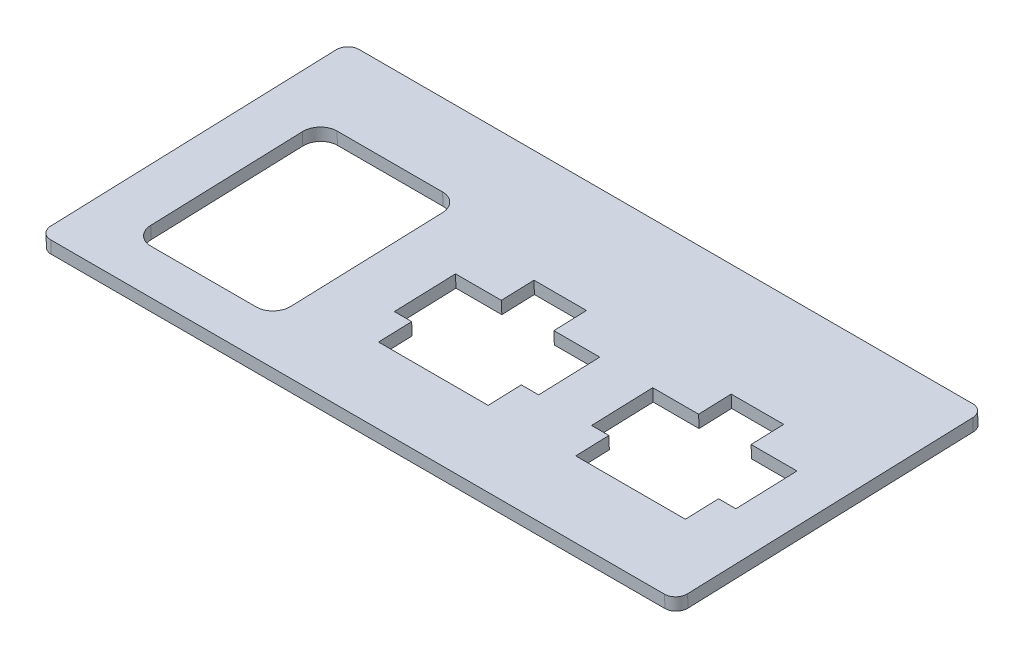
from build123d import *

# Parameters (mm, degrees)
SKETCH1_W           = 110.35
SKETCH1_H           = 53.451961072
BOSS_EXTRUDE1_DEPTH = 2.2
CUT_EXTRUDE1_REACH  = 76.036
FILLET1_R           = 2


with BuildPart() as part:
    # Sketch1 → Boss-Extrude1 (new body)
    with BuildSketch(Plane(origin=(0, -71.98718802, -2.513847999), x_dir=(1, 0, 0), z_dir=(0, 0.9993908270190958, 0.03489949670250105))):
        with Locations((0, 22.514385256)):
            Rectangle(SKETCH1_W, SKETCH1_H)
    extrude(amount=BOSS_EXTRUDE1_DEPTH)

    # Sketch2 → Cut-Extrude1 (cut, up to next)
    with BuildSketch(Plane(origin=(0, -71.98718802, -2.513847999), x_dir=(1, 0, 0), z_dir=(0, -0.9993908270190958, -0.03489949670250106)), mode=Mode.PRIVATE) as cut_extrude1_sk1:
        Polygon((-4.05, -24.762401314), (-4.05, -30.412401314), (5.05, -30.412401314), (5.05, -24.762401314), (13, -24.762401314), (13, -14.162401314), (10, -14.162401314), (10, -8.412401314), (-9, -8.412401314), (-9, -14.162401314), (-12, -14.162401314), (-12, -24.762401314), align=None)
    cut_extrude1_tool1 = extrude(cut_extrude1_sk1.sketch, amount=-CUT_EXTRUDE1_REACH, mode=Mode.PRIVATE) & part.part
    # Sketch2 → Cut-Extrude1 (cut, up to next)
    with BuildSketch(Plane(origin=(0, -71.98718802, -2.513847999), x_dir=(1, 0, 0), z_dir=(0, -0.9993908270190958, -0.03489949670250106)), mode=Mode.PRIVATE) as cut_extrude1_sk2:
        with BuildLine():
            Line((-43.325, -3.262401314), (-25.025, -3.262401314))
            ThreePointArc((-25.025, -3.262401314), (-22.903679656, -4.14108097), (-22.025, -6.262401314))
            Line((-22.025, -6.262401314), (-22.025, -32.562401314))
            ThreePointArc((-22.025, -32.562401314), (-22.903679656, -34.683721657), (-25.025, -35.562401314))
            Line((-25.025, -35.562401314), (-43.325, -35.562401314))
            ThreePointArc((-43.325, -35.562401314), (-45.446320344, -34.683721657), (-46.325, -32.562401314))
            Line((-46.325, -32.562401314), (-46.325, -6.262401314))
            ThreePointArc((-46.325, -6.262401314), (-45.446320344, -4.14108097), (-43.325, -3.262401314))
        make_face()
    cut_extrude1_tool2 = extrude(cut_extrude1_sk2.sketch, amount=-CUT_EXTRUDE1_REACH, mode=Mode.PRIVATE) & part.part
    # Sketch2 → Cut-Extrude1 (cut, up to next)
    with BuildSketch(Plane(origin=(0, -71.98718802, -2.513847999), x_dir=(1, 0, 0), z_dir=(0, -0.9993908270190958, -0.03489949670250106)), mode=Mode.PRIVATE) as cut_extrude1_sk3:
        Polygon((30.125, -24.762401314), (22.175, -24.762401314), (22.175, -14.162401314), (25.175, -14.162401314), (25.175, -8.412401314), (44.175, -8.412401314), (44.175, -14.162401314), (47.175, -14.162401314), (47.175, -24.762401314), (39.225, -24.762401314), (39.225, -30.412401314), (30.125, -30.412401314), align=None)
    cut_extrude1_tool3 = extrude(cut_extrude1_sk3.sketch, amount=-CUT_EXTRUDE1_REACH, mode=Mode.PRIVATE) & part.part
    add(cut_extrude1_tool1.solids().sort_by_distance((0.5, -71.346935, -20.848299))[0], mode=Mode.SUBTRACT)
    add(cut_extrude1_tool2.solids().sort_by_distance((-34.175, -71.309705, -21.914424))[0], mode=Mode.SUBTRACT)
    add(cut_extrude1_tool3.solids().sort_by_distance((34.675, -71.346935, -20.848299))[0], mode=Mode.SUBTRACT)

    # Fillet1
    fillet1_edges = [part.edges().sort_by_distance(p)[0] for p in [
        (-55.175, -71.034840666, 1.733571137),
        (55.175, -71.034840666, 1.733571137),
        (55.175, -69.169394127, -51.685828444),
        (-55.175, -69.169394127, -51.685828444),
    ]]
    fillet(fillet1_edges, radius=FILLET1_R)


solid = part.part
